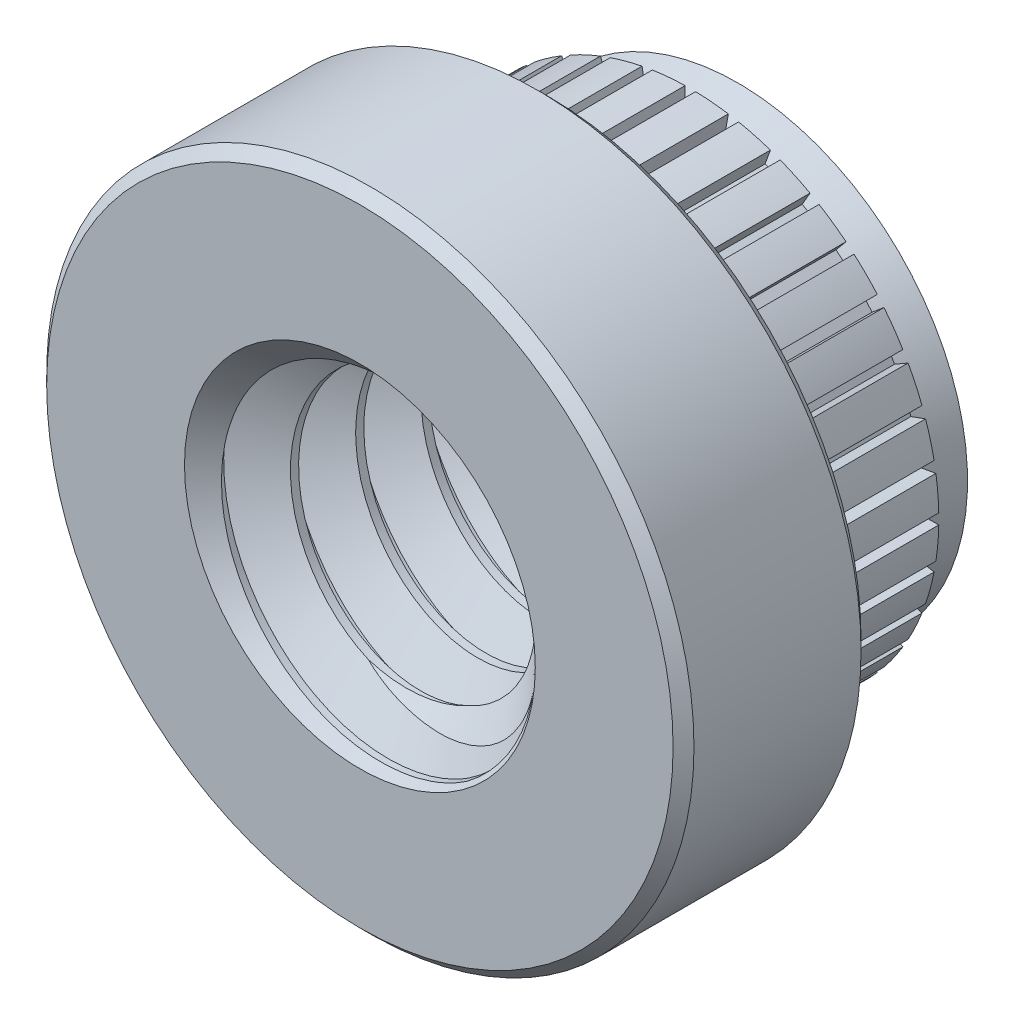
from build123d import *

# Parameters (mm, degrees)
SKETCH1_R               = 3.937
EXTRUDE1_DEPTH          = 2.286
SKETCH2_R               = 3.0226
EXTRUDE2_DEPTH          = 2.3114
SKETCH3_W               = 0.127
SKETCH3_H               = 1.1049
CUT_EXTRUDE_THIN1_DEPTH = 2.3114
CIRPATTERN1_COUNT       = 36
SKETCH5_OUTSIDE_W       = 12.704
SKETCH5_OUTSIDE_H       = 12.704
SKETCH5_OUTSIDE_R       = 2.794
CUT_EXTRUDE1_DEPTH      = 0.57785
CUT_EXTRUDE1_DRAFT      = 20
CHAMFER2_SIZE           = 0.127
SKETCH7_R               = 2.0828
CUT_EXTRUDE3_DEPTH      = 8.220528011
SWEEP1_PITCH            = 0.79375
SKETCH10_R              = 3.937
CUT_EXTRUDE4_DEPTH      = 8.681556393
SKETCH11_R              = 2.794
CUT_EXTRUDE5_DEPTH      = 8.220528075


with BuildPart() as part:
    # Sketch1 → Extrude1 (new body)
    with BuildSketch(Plane.XY):
        Circle(SKETCH1_R)
    extrude(amount=-EXTRUDE1_DEPTH)

    # Sketch2 → Extrude2 (add)
    with BuildSketch(Plane(origin=(0, 0, -2.286), x_dir=(-1, 0, 0), z_dir=(0, 0, -1))):
        with Locations(Location((0, 0, 0), (0, 0, 180))):
            Circle(SKETCH2_R)
    extrude(amount=EXTRUDE2_DEPTH)

    # Sketch3 → Cut-Extrude-Thin1 (cut)
    with BuildSketch(Plane(origin=(0, 0, -4.5974), x_dir=(-1, 0, 0), z_dir=(0, 0, -1))):
        with Locations((0, 3.38455)):
            Rectangle(SKETCH3_W, SKETCH3_H)
    cut_extrude_thin1 = extrude(amount=-CUT_EXTRUDE_THIN1_DEPTH, mode=Mode.SUBTRACT)

    # CirPattern1: Cut-Extrude-Thin1 ×36 about axis
    cirpattern1_axis = Axis((0, 0, 0), (0, 0, 1))
    for i in range(1, CIRPATTERN1_COUNT):
        add(cut_extrude_thin1.rotate(cirpattern1_axis, i * 360 / CIRPATTERN1_COUNT), mode=Mode.SUBTRACT)


with BuildPart() as cut_extrude1_tool:
    # Sketch5 outside → Cut-Extrude1 (with draft: the straight prism first)
    with BuildSketch(Plane(origin=(0, 0, -4.5974), x_dir=(-1, 0, 0), z_dir=(0, 0, -1))):
        Rectangle(SKETCH5_OUTSIDE_W, SKETCH5_OUTSIDE_H)
        Circle(SKETCH5_OUTSIDE_R, mode=Mode.SUBTRACT)
    extrude(amount=-CUT_EXTRUDE1_DEPTH)
    # Cut-Extrude1: the draft: its side faces are tilted about the plane it starts from
    cut_extrude1_sides = [cut_extrude1_tool.faces().sort_by_distance(p)[0] for p in [
        (0, -6.352, -4.308475),
        (-6.352, 0, -4.308475),
        (0, 6.352, -4.308475),
        (6.352, 0, -4.308475),
        (2.794, 0, -4.308475),
    ]]
    draft(cut_extrude1_sides, Plane(origin=(0, 0, -4.5974), x_dir=(-1, 0, 0), z_dir=(0, 0, -1)), CUT_EXTRUDE1_DRAFT)


with BuildPart() as part_1:
    add(part.part)

    # Cut-Extrude1: cut by cut_extrude1_tool
    add(cut_extrude1_tool.part, mode=Mode.SUBTRACT)

    # Chamfer2
    chamfer2_edges = [part_1.edges().sort_by_distance(p)[0] for p in [
        (-3.937, 0, 0),
        (-3.937, 0, -2.286),
    ]]
    chamfer(chamfer2_edges, length=CHAMFER2_SIZE)

    # Sketch7 → Cut-Extrude3 (cut, through all)
    with BuildSketch(Plane.XY):
        Circle(SKETCH7_R)
    extrude(amount=-CUT_EXTRUDE3_DEPTH, mode=Mode.SUBTRACT)

    # Sweep1: arcs per turn and ends read off the stored shape
    # Sweep1: the profile of Sketch9 profile screwed along a right-hand helix through 9.792 turns, 6 arcs to a turn; built about Z, then put on its axis
    sweep1_z = Axis((0, 0, 0), (0, 0, 1))
    sweep1_corners = [(2.0831, 0, -0.694704455), (1.567244252, 0, -0.396875), (1.567244252, 0, -0.29765625), (2.0831, 0, 0.000173205)]
    with BuildLine(mode=Mode.PRIVATE) as sweep1_profile:
        Line(sweep1_corners[0], sweep1_corners[1])
        Line(sweep1_corners[1], sweep1_corners[2])
        Line(sweep1_corners[2], sweep1_corners[3])
        Line(sweep1_corners[3], sweep1_corners[0])
    sweep1_cap = Face(sweep1_profile.wire())
    sweep1_turn_angles = [0, 30, 60, 90, 120, 150, 180, 210, 240, 270, 300, 330, 360]
    sweep1_turn_weights = [1, 0.8660254037844387, 1, 0.8660254037844387, 1, 0.8660254037844387, 1, 0.8660254037844387, 1, 0.8660254037844387, 1, 0.8660254037844387, 1]
    sweep1_turn_rails = [Edge.make_bspline([Vector(p[0], p[1], 0).rotate(sweep1_z, sweep1_turn_angles[k]) / sweep1_turn_weights[k] + Vector(0, 0, p[2] + SWEEP1_PITCH * sweep1_turn_angles[k] / 360) for k in range(13)], [0, 0, 0, 1, 1, 2, 2, 3, 3, 4, 4, 5, 5, 6, 6, 6], 2, sweep1_turn_weights) for p in sweep1_corners]
    sweep1_turn_sides = [Face.make_surface_from_curves(sweep1_turn_rails[p[0]], sweep1_turn_rails[p[1]]) for p in [(0, 1), (1, 2), (2, 3), (3, 0)]]
    sweep1_last_angles = [3240, 3270, 3300, 3330, 3360, 3390, 3420, 3450, 3480, 3502.56, 3525.12]
    sweep1_last_weights = [1, 0.8660254037844387, 1, 0.8660254037844387, 1, 0.8660254037844387, 1, 0.8660254037844387, 1, 0.9234782808577313, 1]
    sweep1_last_rails = [Edge.make_bspline([Vector(p[0], p[1], 0).rotate(sweep1_z, sweep1_last_angles[k]) / sweep1_last_weights[k] + Vector(0, 0, p[2] + SWEEP1_PITCH * sweep1_last_angles[k] / 360) for k in range(11)], [0, 0, 0, 1, 1, 2, 2, 3, 3, 4, 4, 5, 5, 5], 2, sweep1_last_weights) for p in sweep1_corners]
    sweep1_last_sides = [Face.make_surface_from_curves(sweep1_last_rails[p[0]], sweep1_last_rails[p[1]]) for p in [(0, 1), (1, 2), (2, 3), (3, 0)]]
    sweep1 = Plane(origin=(0, 0, -4.5974), x_dir=(0, 1, 0), z_dir=(0, 0, 1)) * Solid(Shell([*[p.moved(Location((0, 0, SWEEP1_PITCH * i))) for i in range(9) for p in sweep1_turn_sides], *sweep1_last_sides, sweep1_cap, sweep1_cap.rotate(sweep1_z, 3525.12).moved(Location((0, 0, SWEEP1_PITCH * 3525.12 / 360)))]))
    add(sweep1)

    # Sketch10 → Cut-Extrude4 (cut, through all)
    with BuildSketch(Plane.XY):
        Circle(SKETCH10_R)
    extrude(amount=CUT_EXTRUDE4_DEPTH, mode=Mode.SUBTRACT)

    # Sketch11 → Cut-Extrude5 (cut, through all)
    with BuildSketch(Plane(origin=(0, 0, -4.5974), x_dir=(-1, 0, 0), z_dir=(0, 0, -1))):
        Circle(SKETCH11_R)
    extrude(amount=CUT_EXTRUDE5_DEPTH, mode=Mode.SUBTRACT)

    # Cut-Extrude6 cone 1 section (through the dimple's axis) → Cut-Extrude6 (revolve, cut)
    with BuildSketch(Plane(origin=(0, 0, 0), x_dir=(0, -1, 0), z_dir=(1, 0, 0))):
        Polygon((0, 0), (2.1336, 0), (0, 2.1336), align=None)
    revolve(axis=Axis((0, 0, 0), (0, 0, -1)), mode=Mode.SUBTRACT)

    # Cut-Extrude7 cone 1 section (through the dimple's axis) → Cut-Extrude7 (revolve, cut)
    with BuildSketch(Plane(origin=(0, 0, -4.5974), x_dir=(0, 1, 0), z_dir=(1, 0, 0))):
        Polygon((0, 0), (2.1336, 0), (0, 2.1336), align=None)
    revolve(axis=Axis((0, 0, -4.5974), (0, 0, 1)), mode=Mode.SUBTRACT)


solid = part_1.part
